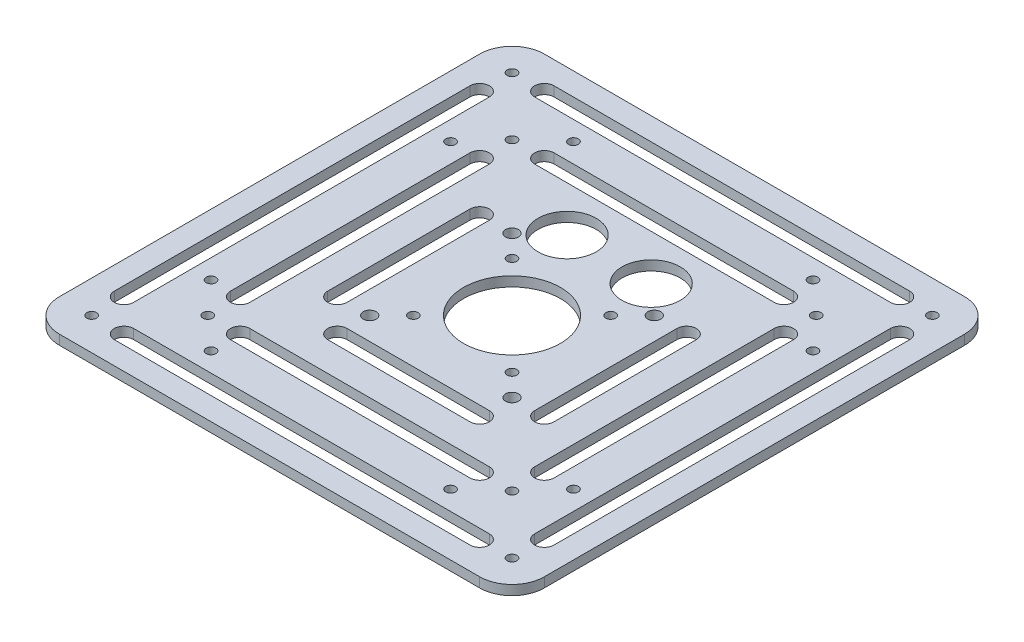
from build123d import *

# Parameters (mm, degrees)
SKETCH1_R           = 1.5
SKETCH1_R_2         = 15
SKETCH1_R_3         = 9
SKETCH1_R_4         = 2
BOSS_EXTRUDE1_DEPTH = 3


with BuildPart() as part:
    # Sketch1 → Boss-Extrude1 (new body)
    with BuildSketch(Plane(origin=(0, 0, 0), x_dir=(1, 0, 0), z_dir=(0, 1, 0))):
        with BuildLine():
            Line((-65, -75), (65, -75))
            ThreePointArc((65, -75), (72.071067812, -72.071067812), (75, -65))
            Line((75, -65), (75, 65))
            ThreePointArc((75, 65), (72.071067812, 72.071067812), (65, 75))
            Line((65, 75), (-65, 75))
            ThreePointArc((-65, 75), (-72.071067812, 72.071067812), (-75, 65))
            Line((-75, 65), (-75, -65))
            ThreePointArc((-75, -65), (-72.071067812, -72.071067812), (-65, -75))
        make_face()
        with Locations((65, 65)):
            Circle(SKETCH1_R, mode=Mode.SUBTRACT)
        with Locations((47.039487758, 47.039487758)):
            Circle(SKETCH1_R, mode=Mode.SUBTRACT)
        with Locations((-65, 65)):
            Circle(SKETCH1_R, mode=Mode.SUBTRACT)
        with Locations((-47.039487758, 47.039487758)):
            Circle(SKETCH1_R, mode=Mode.SUBTRACT)
        with Locations((65, -65)):
            Circle(SKETCH1_R, mode=Mode.SUBTRACT)
        with Locations((47.039487758, -47.039487758)):
            Circle(SKETCH1_R, mode=Mode.SUBTRACT)
        with Locations((-65, -65)):
            Circle(SKETCH1_R, mode=Mode.SUBTRACT)
        with Locations((-47.039487758, -47.039487758)):
            Circle(SKETCH1_R, mode=Mode.SUBTRACT)
        Circle(SKETCH1_R_2, mode=Mode.SUBTRACT)
        with Locations((-56.039487758, 37.039487758)):
            Circle(SKETCH1_R, mode=Mode.SUBTRACT)
        with Locations((-56.039487758, -37.039487758)):
            Circle(SKETCH1_R, mode=Mode.SUBTRACT)
        with Locations((56.039487758, -37.039487758)):
            Circle(SKETCH1_R, mode=Mode.SUBTRACT)
        with Locations((56.039487758, 37.039487758)):
            Circle(SKETCH1_R, mode=Mode.SUBTRACT)
        with Locations((-37.039487758, 56.039487758)):
            Circle(SKETCH1_R, mode=Mode.SUBTRACT)
        with Locations((37.039487758, 56.039487758)):
            Circle(SKETCH1_R, mode=Mode.SUBTRACT)
        with Locations((-37.039487758, -56.039487758)):
            Circle(SKETCH1_R, mode=Mode.SUBTRACT)
        with Locations((37.039487758, -56.039487758)):
            Circle(SKETCH1_R, mode=Mode.SUBTRACT)
        with Locations((-15.25, 15.25)):
            Circle(SKETCH1_R, mode=Mode.SUBTRACT)
        with Locations((15.25, 15.25)):
            Circle(SKETCH1_R, mode=Mode.SUBTRACT)
        with Locations((-15.25, -15.25)):
            Circle(SKETCH1_R, mode=Mode.SUBTRACT)
        with Locations((15.25, -15.25)):
            Circle(SKETCH1_R, mode=Mode.SUBTRACT)
        with Locations((-13, 30.039487758)):
            Circle(SKETCH1_R_3, mode=Mode.SUBTRACT)
        with Locations((13, 30.039487758)):
            Circle(SKETCH1_R_3, mode=Mode.SUBTRACT)
        with Locations((-22, 22)):
            Circle(SKETCH1_R_4, mode=Mode.SUBTRACT)
        with Locations((22, 22)):
            Circle(SKETCH1_R_4, mode=Mode.SUBTRACT)
        with Locations((22, -22)):
            Circle(SKETCH1_R_4, mode=Mode.SUBTRACT)
        with Locations((-22, -22)):
            Circle(SKETCH1_R_4, mode=Mode.SUBTRACT)
        with BuildLine():
            Line((-44.039487758, 37.039487758), (-44.039487758, -37.039487758))
            ThreePointArc((-44.039487758, -37.039487758), (-47.039487758, -40.039487758), (-50.039487758, -37.039487758))
            Line((-50.039487758, -37.039487758), (-50.039487758, 37.039487758))
            ThreePointArc((-50.039487758, 37.039487758), (-47.039487758, 40.039487758), (-44.039487758, 37.039487758))
        make_face(mode=Mode.SUBTRACT)
        with BuildLine():
            Line((44.039487758, 37.039487758), (44.039487758, -37.039487758))
            ThreePointArc((44.039487758, -37.039487758), (47.039487758, -40.039487758), (50.039487758, -37.039487758))
            Line((50.039487758, -37.039487758), (50.039487758, 37.039487758))
            ThreePointArc((50.039487758, 37.039487758), (47.039487758, 40.039487758), (44.039487758, 37.039487758))
        make_face(mode=Mode.SUBTRACT)
        with BuildLine():
            Line((-37.039487758, 44.039487758), (37.039487758, 44.039487758))
            ThreePointArc((37.039487758, 44.039487758), (40.039487758, 47.039487758), (37.039487758, 50.039487758))
            Line((37.039487758, 50.039487758), (-37.039487758, 50.039487758))
            ThreePointArc((-37.039487758, 50.039487758), (-40.039487758, 47.039487758), (-37.039487758, 44.039487758))
        make_face(mode=Mode.SUBTRACT)
        with BuildLine():
            Line((37.039487758, -44.039487758), (-37.039487758, -44.039487758))
            ThreePointArc((-37.039487758, -44.039487758), (-40.039487758, -47.039487758), (-37.039487758, -50.039487758))
            Line((-37.039487758, -50.039487758), (37.039487758, -50.039487758))
            ThreePointArc((37.039487758, -50.039487758), (40.039487758, -47.039487758), (37.039487758, -44.039487758))
        make_face(mode=Mode.SUBTRACT)
        with BuildLine():
            Line((-62, 55), (-62, -55))
            ThreePointArc((-62, -55), (-65, -58), (-68, -55))
            Line((-68, -55), (-68, 55))
            ThreePointArc((-68, 55), (-65, 58), (-62, 55))
        make_face(mode=Mode.SUBTRACT)
        with BuildLine():
            Line((62, 55), (62, -55))
            ThreePointArc((62, -55), (65, -58), (68, -55))
            Line((68, -55), (68, 55))
            ThreePointArc((68, 55), (65, 58), (62, 55))
        make_face(mode=Mode.SUBTRACT)
        with BuildLine():
            Line((-55, 62), (55, 62))
            ThreePointArc((55, 62), (58, 65), (55, 68))
            Line((55, 68), (-55, 68))
            ThreePointArc((-55, 68), (-58, 65), (-55, 62))
        make_face(mode=Mode.SUBTRACT)
        with BuildLine():
            Line((55, -62), (-55, -62))
            ThreePointArc((-55, -62), (-58, -65), (-55, -68))
            Line((-55, -68), (55, -68))
            ThreePointArc((55, -68), (58, -65), (55, -62))
        make_face(mode=Mode.SUBTRACT)
        with BuildLine():
            Line((-22, -29), (22, -29))
            ThreePointArc((22, -29), (25, -32), (22, -35))
            Line((22, -35), (-22, -35))
            ThreePointArc((-22, -35), (-25, -32), (-22, -29))
        make_face(mode=Mode.SUBTRACT)
        with BuildLine():
            Line((-29, -22), (-29, 22))
            ThreePointArc((-29, 22), (-32, 25), (-35, 22))
            Line((-35, 22), (-35, -22))
            ThreePointArc((-35, -22), (-32, -25), (-29, -22))
        make_face(mode=Mode.SUBTRACT)
        with BuildLine():
            Line((29, 22), (29, -22))
            ThreePointArc((29, -22), (32, -25), (35, -22))
            Line((35, -22), (35, 22))
            ThreePointArc((35, 22), (32, 25), (29, 22))
        make_face(mode=Mode.SUBTRACT)
    extrude(amount=BOSS_EXTRUDE1_DEPTH)


solid = part.part
